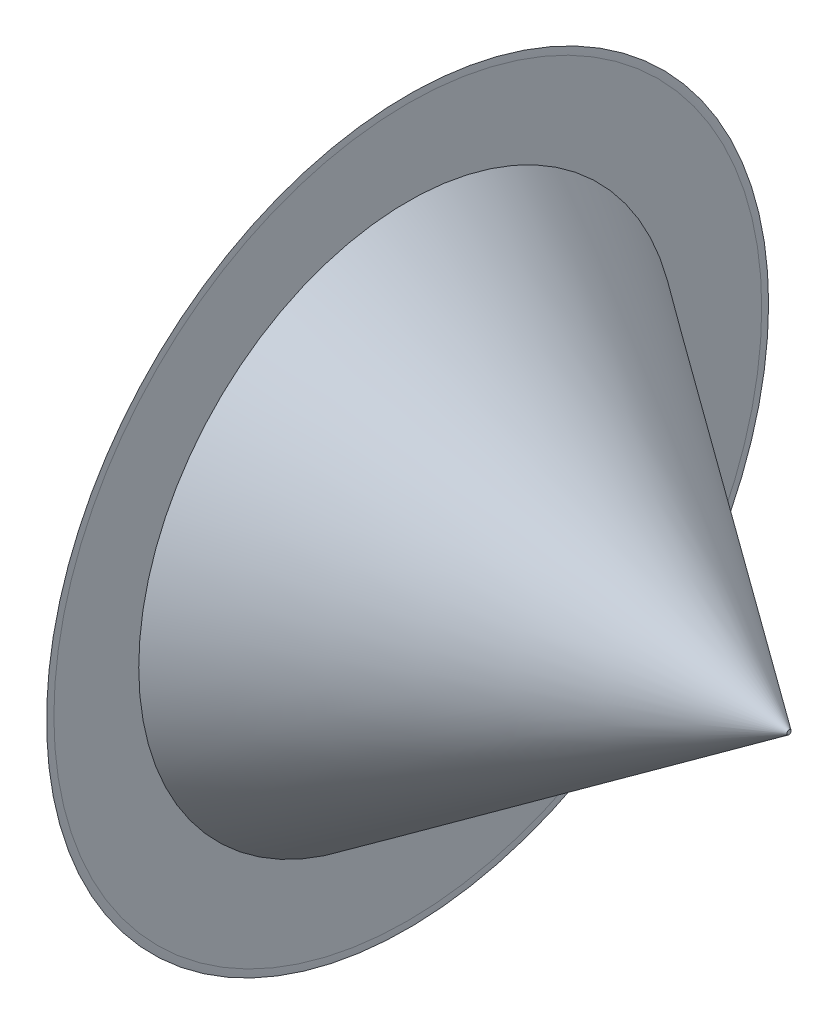
from build123d import *

# Parameters (mm, degrees)
SKETCH1_R           = 16.1
BOSS_EXTRUDE1_DEPTH = 0.01
FILLET1_R           = 5
SKETCH2_R           = 12
BOSS_EXTRUDE2_DEPTH = 17
CHAMFER1_SIZE       = 17
CHAMFER1_SIZE_2     = 11.90352815


with BuildPart() as part:
    # Sketch1 → Boss-Extrude1 (new body)
    with BuildSketch(Plane(origin=(0, 0, 0), x_dir=(0, 0, -1), z_dir=(1, 0, 0))):
        with Locations(Location((0, 0, 0), (0, 0, 180))):
            Circle(SKETCH1_R)
    extrude(amount=BOSS_EXTRUDE1_DEPTH)

    # Fillet1
    # the kernel refuses this fillet: 5 mm, written as the material it takes off along each edge
    with BuildSketch(Plane(origin=(0.01, 0, 0), x_dir=(0, 0, 1), z_dir=(0, 1, 0))) as fillet1_piece_1:
        with BuildLine():
            CenterArc((15.783930387, -5), FILLET1_R, 86.375692506, 3.624307494)
            Line((15.783930387, 0), (16.1, 0))
            Line((16.1, 0), (16.1, -0.01))
        make_face()
    revolve(axis=Axis((0.01, 0, 0), (1, 0, 0)), mode=Mode.SUBTRACT)

    # Sketch2 → Boss-Extrude2 (add)
    with BuildSketch(Plane(origin=(0.01, 0, 0), x_dir=(0, 0, -1), z_dir=(1, 0, 0))):
        Circle(SKETCH2_R)
    extrude(amount=BOSS_EXTRUDE2_DEPTH)

    # Chamfer1
    # the kernel refuses this chamfer: 17, 11.90352815 mm, written as the material it takes off along each edge
    with BuildSketch(Plane(origin=(17.01, 0, 0), x_dir=(0, 0, -1), z_dir=(0, -1, 0))) as chamfer1_piece_1:
        Polygon((12, -CHAMFER1_SIZE), (12 - CHAMFER1_SIZE_2, 0), (12, 0), align=None)
    revolve(axis=Axis((17.01, 0, 0), (1, 0, 0)), mode=Mode.SUBTRACT)


solid = part.part
